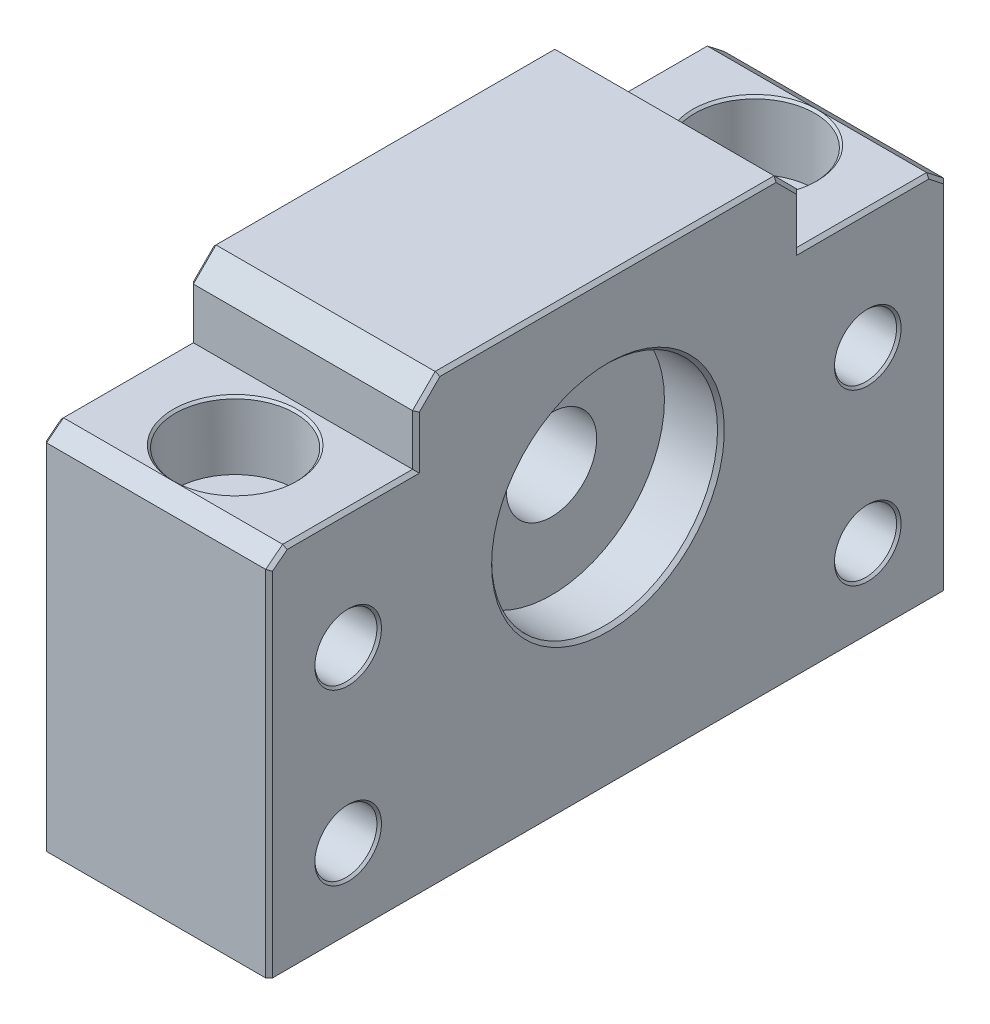
from build123d import *

# Parameters (mm, degrees)
SKETCH1_R                      = 4
SKETCH1_R_2                    = 2.75
BOSS_EXTRUDE1_DEPTH            = 20
SKETCH2_R                      = 10
CUT_EXTRUDE1_DEPTH             = 5
CUT_EXTRUDE2_START             = -5
SKETCH3_R                      = 10
CUT_EXTRUDE2_DEPTH             = 5
CHAMFER2_SIZE                  = 0.2
CHAMFER3_SIZE                  = 0.2
CHAMFER4_SIZE                  = 0.2
CUT_EXTRUDE4_REACH             = 55.113
SKETCH4_R                      = 2.75
CUT_EXTRUDE4_DIRECTION_2_DEPTH = 54.1130869
SKETCH5_R                      = 5.3
CUT_EXTRUDE6_DEPTH             = 6
SKETCH6_R                      = 5.3
CUT_EXTRUDE7_DEPTH             = 6
CHAMFER6_SIZE                  = 0.2
CHAMFER7_SIZE                  = 0.2
CHAMFER11_SIZE                 = 0.3
CHAMFER12_SIZE                 = 0.3


# Some blends are built 0.0001 mm under size
with BuildPart() as part:
    # Sketch1 → Boss-Extrude1 (new body)
    with BuildSketch(Plane(origin=(0, 0, 0), x_dir=(0, 0, -1), z_dir=(1, 0, 0))):
        Polygon((-30, -22), (30, -22), (30, 9.32807156), (28.5, 10.5), (17, 10.5), (17, 15), (15, 17), (-15, 17), (-17, 15), (-17, 10.5), (-28.5, 10.499728155), (-30, 9.327742612), align=None)
        Circle(SKETCH1_R, mode=Mode.SUBTRACT)
        with Locations((-23, 0)):
            Circle(SKETCH1_R_2, mode=Mode.SUBTRACT)
        with Locations((23, 0)):
            Circle(SKETCH1_R_2, mode=Mode.SUBTRACT)
        with Locations((23, -15)):
            Circle(SKETCH1_R_2, mode=Mode.SUBTRACT)
        with Locations((-23, -15)):
            Circle(SKETCH1_R_2, mode=Mode.SUBTRACT)
    extrude(amount=BOSS_EXTRUDE1_DEPTH)

    # Sketch2 → Cut-Extrude1 (cut)
    with BuildSketch(Plane.ZY):
        Circle(SKETCH2_R)
    extrude(amount=-CUT_EXTRUDE1_DEPTH, mode=Mode.SUBTRACT)

    # Sketch3 → Cut-Extrude2 (cut)
    with BuildSketch(Plane(origin=(20, 0, 0), x_dir=(0, 0, -1), z_dir=(1, 0, 0)).offset(CUT_EXTRUDE2_START)):
        with Locations(Location((0, 0, 0), (0, 0, 180))):
            Circle(SKETCH3_R)
    extrude(amount=CUT_EXTRUDE2_DEPTH, mode=Mode.SUBTRACT)

    # Chamfer2
    chamfer2_edges = [part.edges().sort_by_distance(p)[0] for p in [
        (0, 0, -20.25),
    ]]
    chamfer(chamfer2_edges, length=CHAMFER2_SIZE)

    # Chamfer3
    chamfer3_edges = [part.edges().sort_by_distance(p)[0] for p in [
        (0, 0, 25.75),
        (0, -15, -20.25),
        (0, -15, 25.75),
    ]]
    chamfer(chamfer3_edges, length=CHAMFER3_SIZE)

    # Chamfer4
    chamfer4_edges = [part.edges().sort_by_distance(p)[0] for p in [
        (20, 0, -20.25),
        (20, 0, 25.75),
        (20, -15, -20.25),
        (20, -15, 25.75),
    ]]
    chamfer(chamfer4_edges, length=CHAMFER4_SIZE)

    # Cut-Extrude4: up to this face of the body (flat: up to its plane)
    cut_extrude4_end = Plane(part.part.faces().sort_by_distance((10, 10.5, -22.75))[0])
    # Sketch4 → Cut-Extrude4 (cut, up to the picked face)
    with BuildSketch(Plane.XZ.offset(22), mode=Mode.PRIVATE) as cut_extrude4_sk1:
        with Locations(Location((10, 23, 0), (0, 0, 270))):
            Circle(SKETCH4_R)
    cut_extrude4_tool1 = split(extrude(cut_extrude4_sk1.sketch, amount=-CUT_EXTRUDE4_REACH, mode=Mode.PRIVATE), bisect_by=cut_extrude4_end, keep=Keep.BOTH, mode=Mode.PRIVATE)
    # Sketch4 → Cut-Extrude4 (cut, up to the picked face)
    with BuildSketch(Plane.XZ.offset(22), mode=Mode.PRIVATE) as cut_extrude4_sk2:
        with Locations(Location((10, -23, 0), (0, 0, 270))):
            Circle(SKETCH4_R)
    cut_extrude4_tool2 = split(extrude(cut_extrude4_sk2.sketch, amount=-CUT_EXTRUDE4_REACH, mode=Mode.PRIVATE), bisect_by=cut_extrude4_end, keep=Keep.BOTH, mode=Mode.PRIVATE)
    add(cut_extrude4_tool1.solids().sort_by(Axis((10, -22, 23), (0, 1, 0)))[0], mode=Mode.SUBTRACT)
    add(cut_extrude4_tool2.solids().sort_by(Axis((10, -22, -23), (0, 1, 0)))[0], mode=Mode.SUBTRACT)

    # Sketch4 → Cut-Extrude4 direction 2 (cut)
    with BuildSketch(Plane.XZ.offset(22)):
        with Locations(Location((10, 23, 0), (0, 0, 270))):
            Circle(SKETCH4_R)
        with Locations(Location((10, -23, 0), (0, 0, 270))):
            Circle(SKETCH4_R)
    extrude(amount=CUT_EXTRUDE4_DIRECTION_2_DEPTH, mode=Mode.SUBTRACT)

    # Sketch5 → Cut-Extrude6 (cut)
    with BuildSketch(Plane(origin=(0, 10.5, 0), x_dir=(1, 0, 0), z_dir=(0, 1, 0))):
        with Locations(Location((10, 23, 0), (0, 0, 270))):
            Circle(SKETCH5_R)
    extrude(amount=-CUT_EXTRUDE6_DEPTH, mode=Mode.SUBTRACT)

    # Sketch6 → Cut-Extrude7 (cut)
    with BuildSketch(Plane(origin=(0, 10.500401852, 0.000248216), x_dir=(1, 0, 0), z_dir=(0, 0.9999999997206055, 2.3638723279467724e-05))):
        with Locations(Location((10, -23.000354574, 0), (0, 0, 270))):
            Circle(SKETCH6_R)
    extrude(amount=-CUT_EXTRUDE7_DEPTH, mode=Mode.SUBTRACT)

    # Chamfer6
    # the kernel refuses this chamfer: 0.2 mm, written as the material it takes off along each edge
    with BuildSketch(Plane(origin=(10, 10.499858153, 23.000602784), x_dir=(0, -2.363872327936284e-05, 0.9999999997206054), z_dir=(-1, 0, 0))) as chamfer6_piece_1:
        Polygon((5.3 + CHAMFER6_SIZE, 0), (5.3, -CHAMFER6_SIZE), (5.3, 0), align=None)
    revolve(axis=Axis((10, 10.499858153, 23.000602784), (0, 0.9999999997206055, 2.3638723279467724e-05)), mode=Mode.SUBTRACT)

    # Chamfer7
    chamfer7_edges = [part.edges().sort_by_distance(p)[0] for p in [
        (10, 10.5, -28.3),
    ]]
    chamfer(chamfer7_edges, length=CHAMFER7_SIZE - 0.0001)  # a hair under: the kernel refuses the full size

    # Chamfer11
    chamfer11_edges = [part.edges().sort_by_distance(p)[0] for p in [
        (20, -6.336128694, 30),
        (20, -6.33596422, -30),
        (20, 9.91403578, -29.25),
        (20, 10.5, -22.75),
        (20, 12.75, -17),
        (20, 16, -16),
        (20, 17, 0),
        (20, 16, 16),
        (20, 12.75, 17),
        (20, 10.499864077, 22.75),
        (20, 0, -10),
        (20, 9.913735383, 29.25),
    ]]
    chamfer(chamfer11_edges, length=CHAMFER11_SIZE)

    # Chamfer12
    chamfer12_edges = [part.edges().sort_by_distance(p)[0] for p in [
        (0, 12.75, 17),
        (0, 16, 16),
        (0, 17, 0),
        (0, 16, -16),
        (0, 12.75, -17),
        (0, 10.5, -22.75),
        (0, 9.91403578, -29.25),
        (0, -6.33596422, -30),
        (0, -6.336128694, 30),
        (0, 9.913735383, 29.25),
        (0, 10.499864077, 22.75),
        (0, 0, -10),
    ]]
    chamfer(chamfer12_edges, length=CHAMFER12_SIZE)


solid = part.part
